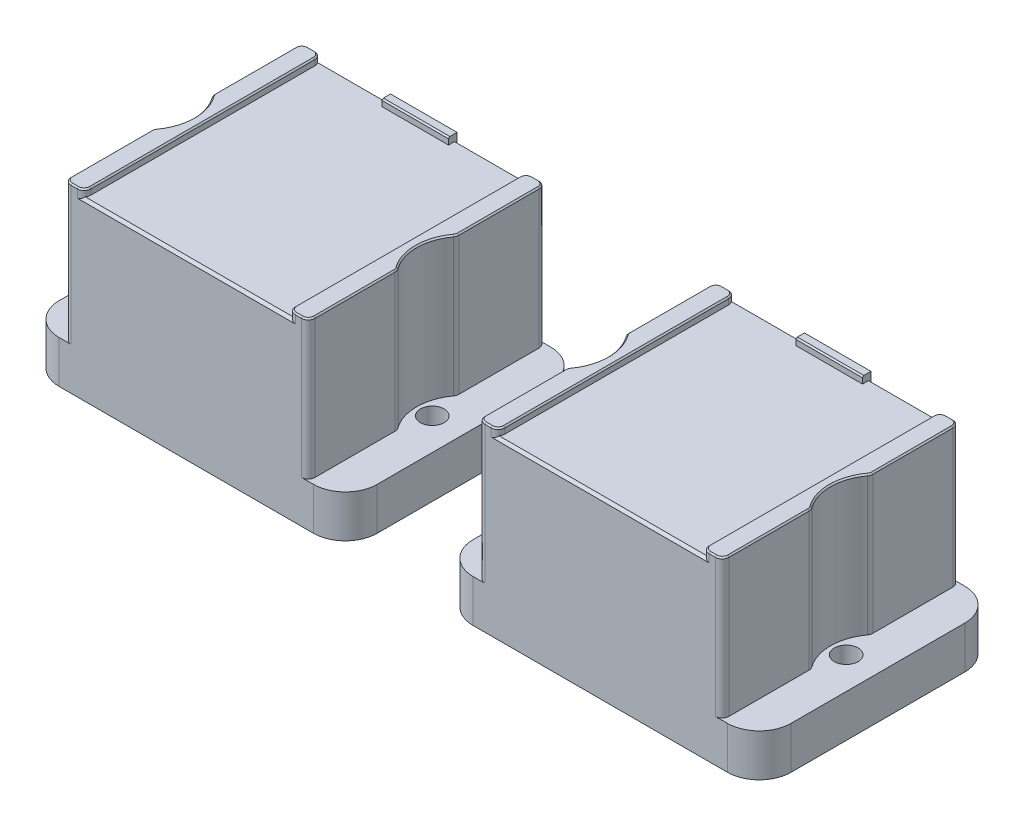
from build123d import *

# Parameters (mm, degrees)
EXTRUDE1_DEPTH                       = 27.178
SKETCH8_W                            = 50.8
SKETCH8_H                            = 50.8
EXTRUDE2_DEPTH                       = 6.35
CUT_EXTRUDE1_DEPTH                   = 1.016
FILLET3_R                            = 1.016
SKETCH9_OUTSIDE_W                    = 68.162
SKETCH9_OUTSIDE_H                    = 68.162
SKETCH9_OUTSIDE_W_2                  = 47.625
SKETCH9_OUTSIDE_H_2                  = 35.56
CUT_EXTRUDE3_DEPTH                   = 46.044019403
F_28_0_1405_DIAMETER_HOLE1_OUTLINE_R = 1.78435
F_28_0_1405_DIAMETER_HOLE1_DEPTH     = 6.35
FILLET5_R                            = 4.7752
FILLET2_R                            = 1.016
CHAMFER4_SIZE                        = 0.2032
CHAMFER5_SIZE                        = 0.381


# Read off the part's stored shape, not the designer's step: #28 (0.1405) Diameter Hole1
with BuildPart() as part:
    # Sketch1 → Extrude1 (new body)
    with BuildSketch(Plane(origin=(0, 0, 0), x_dir=(1, 0, 0), z_dir=(0, 1, 0))):
        with BuildLine():
            Line((-18.2626, 17.78), (18.2626, 17.78))
            Line((18.2626, 17.78), (18.2626, 4.431481156))
            ThreePointArc((18.2626, 4.431481156), (16.7132, 0), (18.2626, -4.431481156))
            Line((18.2626, -4.431481156), (18.2626, -17.78))
            Line((18.2626, -17.78), (-18.2626, -17.78))
            Line((-18.2626, -17.78), (-18.2626, -4.431481156))
            ThreePointArc((-18.2626, -4.431481156), (-16.7132, 0), (-18.2626, 4.431481156))
            Line((-18.2626, 4.431481156), (-18.2626, 17.78))
        make_face()
    extrude(amount=EXTRUDE1_DEPTH)

    # Sketch8 → Extrude2 (add)
    with BuildSketch(Plane(origin=(0, 0, 0), x_dir=(1, 0, 0), z_dir=(0, 1, 0))):
        Rectangle(SKETCH8_W, SKETCH8_H)
    extrude(amount=EXTRUDE2_DEPTH)

    # Sketch6 → Cut-Extrude1 (cut)
    with BuildSketch(Plane(origin=(0, 27.178, 0), x_dir=(-1, 0, 0), z_dir=(0, 1, 0))):
        Polygon((-15.3035, 24.453887049), (15.3035, 24.453887049), (15.3035, -24.453887049), (4.9784, -24.453887049), (4.9784, -16.51), (-4.9784, -16.51), (-4.9784, -24.453887049), (-15.3035, -24.453887049), align=None)
    extrude(amount=-CUT_EXTRUDE1_DEPTH, mode=Mode.SUBTRACT)

    # Fillet3
    fillet3_edges = [part.edges().sort_by_distance(p)[0] for p in [
        (-18.2626, 16.764, -17.78),
        (18.2626, 16.764, -17.78),
        (18.2626, 16.764, -4.431481156),
        (18.2626, 16.764, 4.431481156),
        (18.2626, 16.764, 17.78),
        (-18.2626, 16.764, 17.78),
        (-18.2626, 16.764, 4.431481156),
        (-18.2626, 16.764, -4.431481156),
    ]]
    fillet(fillet3_edges, radius=FILLET3_R)

    # Sketch9 outside → Cut-Extrude3 (cut, through all)
    with BuildSketch(Plane(origin=(0, 0, 0), x_dir=(1, 0, 0), z_dir=(0, 1, 0))):
        Rectangle(SKETCH9_OUTSIDE_W, SKETCH9_OUTSIDE_H)
        Rectangle(SKETCH9_OUTSIDE_W_2, SKETCH9_OUTSIDE_H_2, mode=Mode.SUBTRACT)
    extrude(amount=CUT_EXTRUDE3_DEPTH, mode=Mode.SUBTRACT)

    # #28 (0.1405) Diameter Hole1 outline → #28 (0.1405) Diameter Hole1 (cut)
    with BuildSketch(Plane(origin=(0, 0, 0), x_dir=(1, 0, 0), z_dir=(0, 1, 0))):
        with Locations((19.05, 0)):
            Circle(F_28_0_1405_DIAMETER_HOLE1_OUTLINE_R)
        with Locations((-19.05, 0)):
            Circle(F_28_0_1405_DIAMETER_HOLE1_OUTLINE_R)
    extrude(amount=F_28_0_1405_DIAMETER_HOLE1_DEPTH, mode=Mode.SUBTRACT)

    # Fillet5
    fillet5_edges = [part.edges().sort_by_distance(p)[0] for p in [
        (-23.8125, 3.175, 17.78),
        (23.8125, 3.175, 17.78),
        (23.8125, 3.175, -17.78),
        (-23.8125, 3.175, -17.78),
    ]]
    fillet(fillet5_edges, radius=FILLET5_R)

    # Fillet2
    fillet2_edges = [part.edges().sort_by_distance(p)[0] for p in [
        (-15.3035, 26.67, 17.78),
        (-15.3035, 26.67, -17.78),
        (15.3035, 26.67, 17.78),
        (15.3035, 26.67, -17.78),
    ]]
    fillet(fillet2_edges, radius=FILLET2_R)

    # Chamfer4
    chamfer4_edges = [part.edges().sort_by_distance(p)[0] for p in [
        (16.78305, 27.178, -17.78),
        (18.2626, 27.178, -10.768755436),
        (17.96502049, 27.178, 17.48242049),
        (17.96502049, 27.178, -17.48242049),
        (18.212969029, 27.178, -4.45984401),
        (18.212969029, 27.178, 4.45984401),
        (16.78305, 27.178, 17.78),
        (-15.3035, 27.178, 0),
        (-16.78305, 27.178, -17.78),
        (-15.60107951, 27.178, -17.48242049),
        (-15.60107951, 27.178, 17.48242049),
        (15.3035, 27.178, 0),
        (15.60107951, 27.178, 17.48242049),
        (15.60107951, 27.178, -17.48242049),
        (0, 27.178, -16.51),
        (-18.2626, 27.178, 10.768755436),
        (-16.7132, 27.178, 0),
        (-16.78305, 27.178, 17.78),
        (-18.2626, 27.178, -10.768755436),
        (-17.96502049, 27.178, 17.48242049),
        (-17.96502049, 27.178, -17.48242049),
        (-18.212969029, 27.178, -4.45984401),
        (-18.212969029, 27.178, 4.45984401),
        (16.7132, 27.178, 0),
        (18.2626, 27.178, 10.768755436),
    ]]
    chamfer(chamfer4_edges, length=CHAMFER4_SIZE)

    # Chamfer5
    chamfer5_edges = [part.edges().sort_by_distance(p)[0] for p in [
        (10.64895, 26.162, -17.78),
        (-10.64895, 26.162, -17.78),
        (0, 26.162, 17.78),
    ]]
    chamfer(chamfer5_edges, length=CHAMFER5_SIZE)


with BuildPart() as body_2:
    # Body-Move/Copy1: copy of part
    add(part.part.moved(Location((61.976, -5e-08, 0))))


solid = Compound([part.part, body_2.part])
